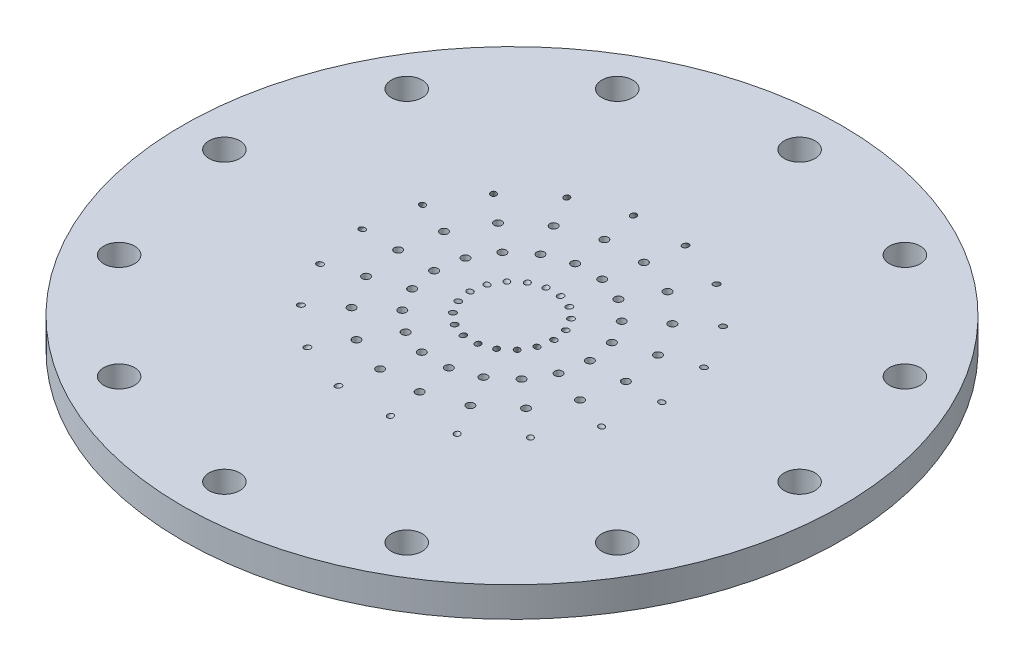
from build123d import *

# Parameters (mm, degrees)
SKETCH1_R           = 69.85
BOSS_EXTRUDE1_DEPTH = 6.35
SKETCH4_R           = 0.59055
CUT_EXTRUDE1_DEPTH  = 103.436683845
SKETCH6_R           = 0.59055
CUT_EXTRUDE2_DEPTH  = 104.657544816
SKETCH7_R           = 0.8255
LOX_HOLES_DEPTH     = 99.986703653
CIRPATTERN1_COUNT   = 18
SKETCH8_R           = 3.2639
CUT_EXTRUDE4_DEPTH  = 99.986703653
CIRPATTERN2_COUNT   = 12


with BuildPart() as part:
    # Sketch1 → Boss-Extrude1 (new body)
    with BuildSketch(Plane(origin=(0, 0, 0), x_dir=(1, 0, 0), z_dir=(0, 1, 0))):
        Circle(SKETCH1_R)
    extrude(amount=BOSS_EXTRUDE1_DEPTH)

    # Sketch4 → Cut-Extrude1 (cut, through all)
    with BuildSketch(Plane(origin=(-3.917869343, -6.785948759, 0), x_dir=(-0.866025403784438, 0.500000000000001, 0), z_dir=(0.500000000000001, 0.866025403784438, 0))):
        with Locations((-4.52396584, 0)):
            Circle(SKETCH4_R)
    cut_extrude1 = extrude(amount=CUT_EXTRUDE1_DEPTH, mode=Mode.SUBTRACT)

    # Sketch6 → Cut-Extrude2 (cut, symmetric)
    with BuildSketch(Plane(origin=(5.187869343, -8.985653285, 0), x_dir=(0.8660254037844362, 0.5000000000000044, 0), z_dir=(0.5000000000000044, -0.8660254037844362, 0))):
        with Locations((30.67130657, 0)):
            Circle(SKETCH6_R)
    cut_extrude2 = extrude(amount=CUT_EXTRUDE2_DEPTH, both=True, mode=Mode.SUBTRACT)

    # Sketch7 → LOx Holes (cut, symmetric)
    with BuildSketch(Plane(origin=(0, 6.35, 0), x_dir=(1, 0, 0), z_dir=(0, 1, 0))):
        with Locations((24.13, 0)):
            Circle(SKETCH7_R)
        with Locations((16.51, 0)):
            Circle(SKETCH7_R)
    lox_holes = extrude(amount=LOX_HOLES_DEPTH, both=True, mode=Mode.SUBTRACT)

    # CirPattern1: Cut-Extrude1, Cut-Extrude2, LOx Holes ×18 about axis
    cirpattern1_axis = Axis((0, 6.35, 0), (0, -1, 0))
    add([cut_extrude1.rotate(cirpattern1_axis, i * 360 / CIRPATTERN1_COUNT) for i in range(1, CIRPATTERN1_COUNT)], mode=Mode.SUBTRACT)
    add([cut_extrude2.rotate(cirpattern1_axis, i * 360 / CIRPATTERN1_COUNT) for i in range(1, CIRPATTERN1_COUNT)], mode=Mode.SUBTRACT)
    add([lox_holes.rotate(cirpattern1_axis, i * 360 / CIRPATTERN1_COUNT) for i in range(1, CIRPATTERN1_COUNT)], mode=Mode.SUBTRACT)

    # Sketch8 → Cut-Extrude4 (cut, through all)
    with BuildSketch(Plane.XZ):
        with Locations((-60.96, 0)):
            Circle(SKETCH8_R)
    cut_extrude4 = extrude(amount=-CUT_EXTRUDE4_DEPTH, mode=Mode.SUBTRACT)

    # CirPattern2: Cut-Extrude4 ×12 about axis
    cirpattern2_axis = Axis((0, 6.35, 0), (0, -1, 0))
    for i in range(1, CIRPATTERN2_COUNT):
        add(cut_extrude4.rotate(cirpattern2_axis, i * 360 / CIRPATTERN2_COUNT), mode=Mode.SUBTRACT)


solid = part.part
